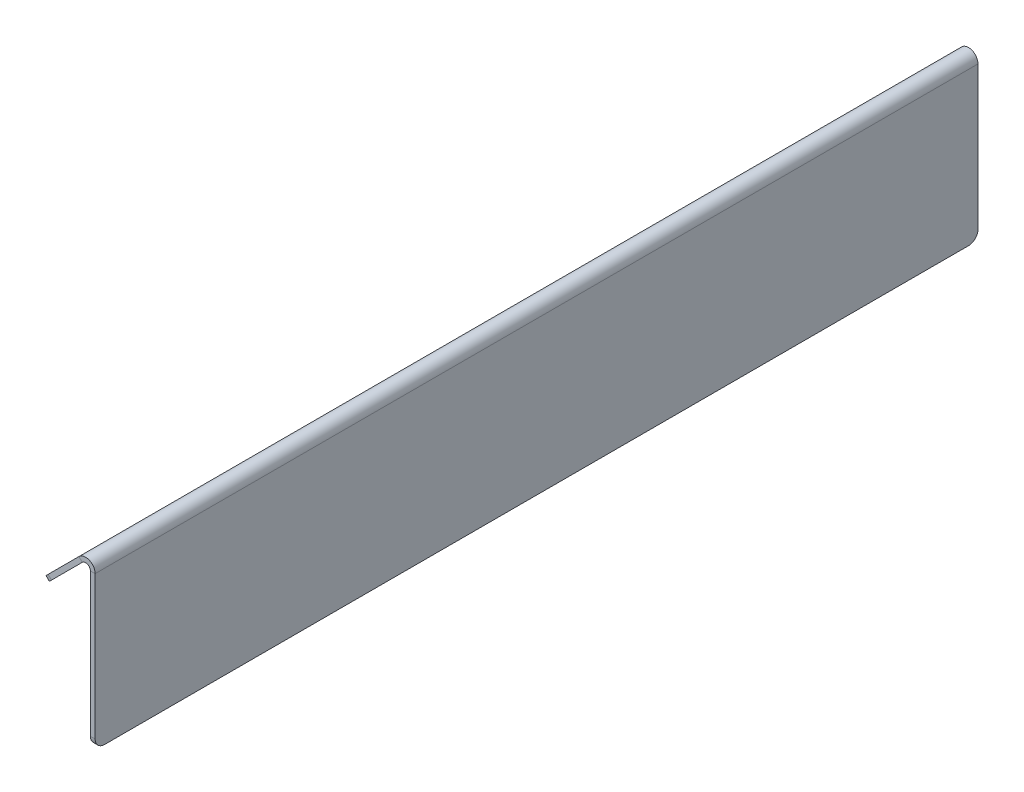
from build123d import *

# Parameters (mm, degrees)
SKETCH1_W            = 590.55
SKETCH1_H            = 114.3
BASE_FLANGE1_DEPTH   = 3.175
EDGE_FLANGE1_START   = -590.55
EDGE_FLANGE1_DEPTH   = 590.55
EDGE_FLANGE1_2_DEPTH = 590.55
FILLET1_R            = 6.35
SKETCH9_R            = 2.45745
CUT_EXTRUDE1_DEPTH   = 3.18516


# Read off the part's stored shape, not the designer's step: Edge-Flange1
# Sheet-metal steps are written as plain solids
with BuildPart() as part:
    # Sketch1 → Base-Flange1 (new body)
    with BuildSketch(Plane(origin=(0, 0, 0), x_dir=(0, 0, -1), z_dir=(1, 0, 0))):
        with Locations((295.275, 57.15)):
            Rectangle(SKETCH1_W, SKETCH1_H)
    extrude(amount=-BASE_FLANGE1_DEPTH)

    # Edge-Flange1 outline → Edge-Flange1 (cut)
    with BuildSketch(Plane.XY.offset(EDGE_FLANGE1_START)):
        with BuildLine():
            Line((-3.175, 114.3), (-3.175, 107.644005193))
            ThreePointArc((-3.175, 107.644005193), (-0.850738686, 105.319743879), (0, 102.144743879))
            Line((0, 102.144743879), (0, 114.3))
            Line((0, 114.3), (-3.175, 114.3))
        make_face()
    extrude(amount=EDGE_FLANGE1_DEPTH, mode=Mode.SUBTRACT)

    # Edge-Flange1 2 outline → Edge-Flange1 2 (add)
    with BuildSketch(Plane.XY.offset(EDGE_FLANGE1_START)):
        with BuildLine():
            ThreePointArc((-3.175, 107.644005193), (-7.178841321, 108.440418748), (-10.840128061, 106.634871939))
            Line((-10.840128061, 106.634871939), (-35.921024484, 81.553975516))
            Line((-35.921024484, 81.553975516), (-33.675960454, 79.308911485))
            Line((-33.675960454, 79.308911485), (-8.59506403, 104.389807909))
            ThreePointArc((-8.59506403, 104.389807909), (-5.134980102, 105.078061395), (-3.175, 102.144743879))
            Line((-3.175, 102.144743879), (-3.175, 107.644005193))
        make_face()
    extrude(amount=EDGE_FLANGE1_2_DEPTH)

    # Fillet1
    fillet1_edges = [part.edges().sort_by_distance(p)[0] for p in [
        (-34.798492469, 80.4314435, 0),
        (-34.798492469, 80.4314435, -590.55),
        (-1.5875, 0, -590.55),
        (-1.5875, 0, 0),
    ]]
    fillet(fillet1_edges, radius=FILLET1_R)

    # Sketch9 → Cut-Extrude1 (cut)
    with BuildSketch(Plane(origin=(-58.7375, 58.7375, 0), x_dir=(0, 0, 1), z_dir=(-0.7071067811865465, 0.7071067811865487, 0))):
        with Locations(Location((-542.925, 48.687112999, 0), (0, 0, 270))):
            Circle(SKETCH9_R)
        with Locations(Location((-295.275, 48.687112999, 0), (0, 0, 270))):
            Circle(SKETCH9_R)
        with Locations(Location((-47.625, 48.687112999, 0), (0, 0, 270))):
            Circle(SKETCH9_R)
    extrude(amount=-CUT_EXTRUDE1_DEPTH, mode=Mode.SUBTRACT)


solid = part.part
